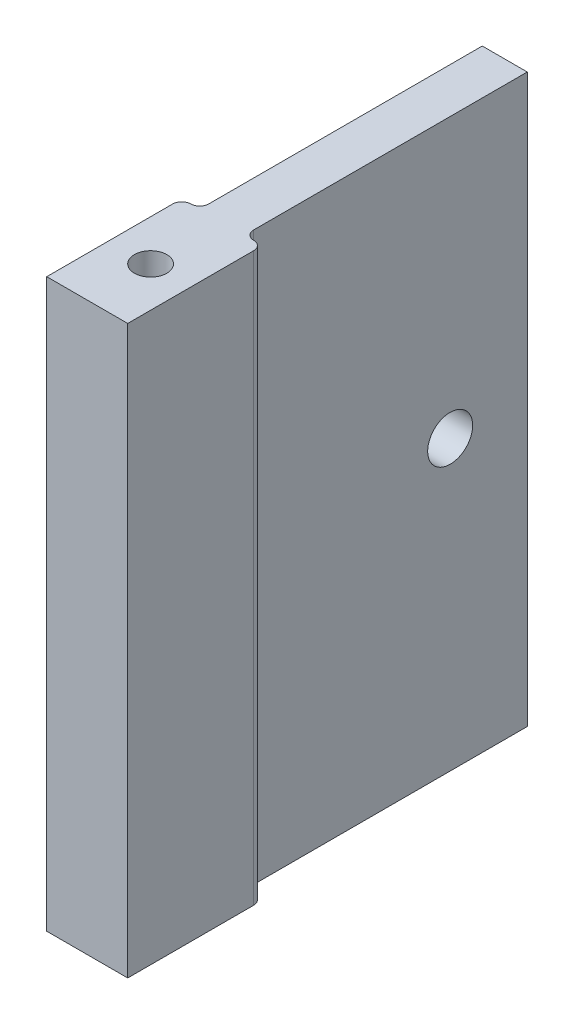
from build123d import *

# Parameters (mm, degrees)
ESQUISSE1_W                  = 9
ESQUISSE1_H                  = 63
BOSS_EXTRU_1_DEPTH           = 10
ESQUISSE2_W                  = 5
ESQUISSE2_H                  = 63
BOSS_EXTRU_2_DEPTH           = 63
CONG_3_R                     = 1
CONG_4_R                     = 1
CONG_5_R                     = 1
CONG_6_R                     = 1
ESQUISSE3_R                  = 2.5
ENL_V_MAT_EXTRU_1_DEPTH      = 77.075062882
ENL_V_MAT_EXTRU_3_DEPTH      = 77.075062882
ENL_V_MAT_EXTRU_3_DEPTH_BACK = 77.075062882
ESQUISSE9_R                  = 2.5
ENL_V_MAT_EXTRU_4_DEPTH      = 23
ESQUISSE12_W                 = 9
ESQUISSE12_H                 = 63
BOSS_EXTRU_4_DEPTH           = 5
ESQUISSE13_R                 = 1.8
ENL_V_MAT_EXTRU_6_DEPTH      = 4
ENL_V_START                  = -4
ESQUISSE14_R                 = 1.8
ENL_V_MAT_EXTRU_7_DEPTH      = 4


with BuildPart() as part:
    # Esquisse1 → Boss.-Extru.1 (new body)
    with BuildSketch(Plane.XY):
        with Locations((-9.542944785, -10.564417178)):
            Rectangle(ESQUISSE1_W, ESQUISSE1_H)
    extrude(amount=BOSS_EXTRU_1_DEPTH)

    # Esquisse2 → Boss.-Extru.2 (add)
    with BuildSketch(Plane(origin=(0, 0, 0), x_dir=(-1, 0, 0), z_dir=(0, 0, -1))):
        with Locations((9.542944785, -10.564417178)):
            Rectangle(ESQUISSE2_W, ESQUISSE2_H)
    extrude(amount=BOSS_EXTRU_2_DEPTH)

    # Congé3
    cong_3_edges = [part.edges().sort_by_distance(p)[0] for p in [
        (-7.042944785, -10.564417178, 0),
    ]]
    fillet(cong_3_edges, radius=CONG_3_R)

    # Congé4
    cong_4_edges = [part.edges().sort_by_distance(p)[0] for p in [
        (-12.042944785, -10.564417178, 0),
    ]]
    fillet(cong_4_edges, radius=CONG_4_R)

    # Congé5
    cong_5_edges = [part.edges().sort_by_distance(p)[0] for p in [
        (-5.042944785, -10.564417178, 0),
    ]]
    fillet(cong_5_edges, radius=CONG_5_R - 0.0001)  # a hair under: the kernel refuses the full size

    # Congé6
    cong_6_edges = [part.edges().sort_by_distance(p)[0] for p in [
        (-14.042944785, -10.564417178, 0),
    ]]
    fillet(cong_6_edges, radius=CONG_6_R - 0.0001)  # a hair under: the kernel refuses the full size

    # Esquisse3 → Enlèv. mat.-Extru.1 (cut, through all)
    with BuildSketch(Plane.ZY.offset(12.042944785)):
        with Locations(Location((-43, -10.564417178, 0), (0, 0, 270))):
            Circle(ESQUISSE3_R)
    extrude(amount=-ENL_V_MAT_EXTRU_1_DEPTH, mode=Mode.SUBTRACT)

    # Esquisse7 → Enlèv. mat.-Extru.3 (cut, two sides: drawn at the far end of the back side and taken through both)
    with BuildSketch(Plane(origin=(-7.042944785, 0, 0), x_dir=(0, 0, -1), z_dir=(1, 0, 0)).offset(-ENL_V_MAT_EXTRU_3_DEPTH_BACK)):
        Polygon((51.248405369, 207.781395644), (51.248405369, 20.935582822), (51.248405369, -42.839359106), (51.248405369, -229.685171928), (424.940031013, -229.685171928), (424.940031013, 207.781395644), align=None)
    extrude(amount=ENL_V_MAT_EXTRU_3_DEPTH + ENL_V_MAT_EXTRU_3_DEPTH_BACK, mode=Mode.SUBTRACT)


with BuildPart() as body_2:
    # Fractionner1: the piece on the far side of the plane
    add(part.part)
    split(bisect_by=Plane.XY.offset(-31.402624734), keep=Keep.BOTTOM)


with BuildPart() as part_1:
    add(part.part)

    # Fractionner1
    split(bisect_by=Plane.XY.offset(-31.402624734), keep=Keep.TOP)

    # Esquisse9 → Enlèv. mat.-Extru.4 (cut)
    with BuildSketch(Plane(origin=(-7.042944785, 0, 0), x_dir=(0, 0, -1), z_dir=(1, 0, 0))):
        with Locations(Location((22.835321424, -10.036411033, 0), (0, 0, 90))):
            Circle(ESQUISSE9_R)
    extrude(amount=-ENL_V_MAT_EXTRU_4_DEPTH, mode=Mode.SUBTRACT)

    # Esquisse12 → Boss.-Extru.4 (add)
    with BuildSketch(Plane.XY.offset(10)):
        with Locations((-9.542944785, -10.564417178)):
            Rectangle(ESQUISSE12_W, ESQUISSE12_H)
    extrude(amount=BOSS_EXTRU_4_DEPTH)

    # Esquisse13 → Enlèv. mat.-Extru.6 (cut)
    with BuildSketch(Plane(origin=(0, 20.935582822, 0), x_dir=(1, 0, 0), z_dir=(0, 1, 0))):
        with Locations(Location((-9.5, -8, 0), (0, 0, 180))):
            Circle(ESQUISSE13_R)
    extrude(amount=-ENL_V_MAT_EXTRU_6_DEPTH, mode=Mode.SUBTRACT)

    # Esquisse14 → Enlèv. mat.-Extru.7 (cut)
    with BuildSketch(Plane(origin=(0, -42.064417178, 0), x_dir=(-1, 0, 0), z_dir=(0, -1, 0)).offset(ENL_V_START)):
        with Locations((9.5, -8)):
            Circle(ESQUISSE14_R)
    extrude(amount=ENL_V_MAT_EXTRU_7_DEPTH, mode=Mode.SUBTRACT)


solid = part_1.part
